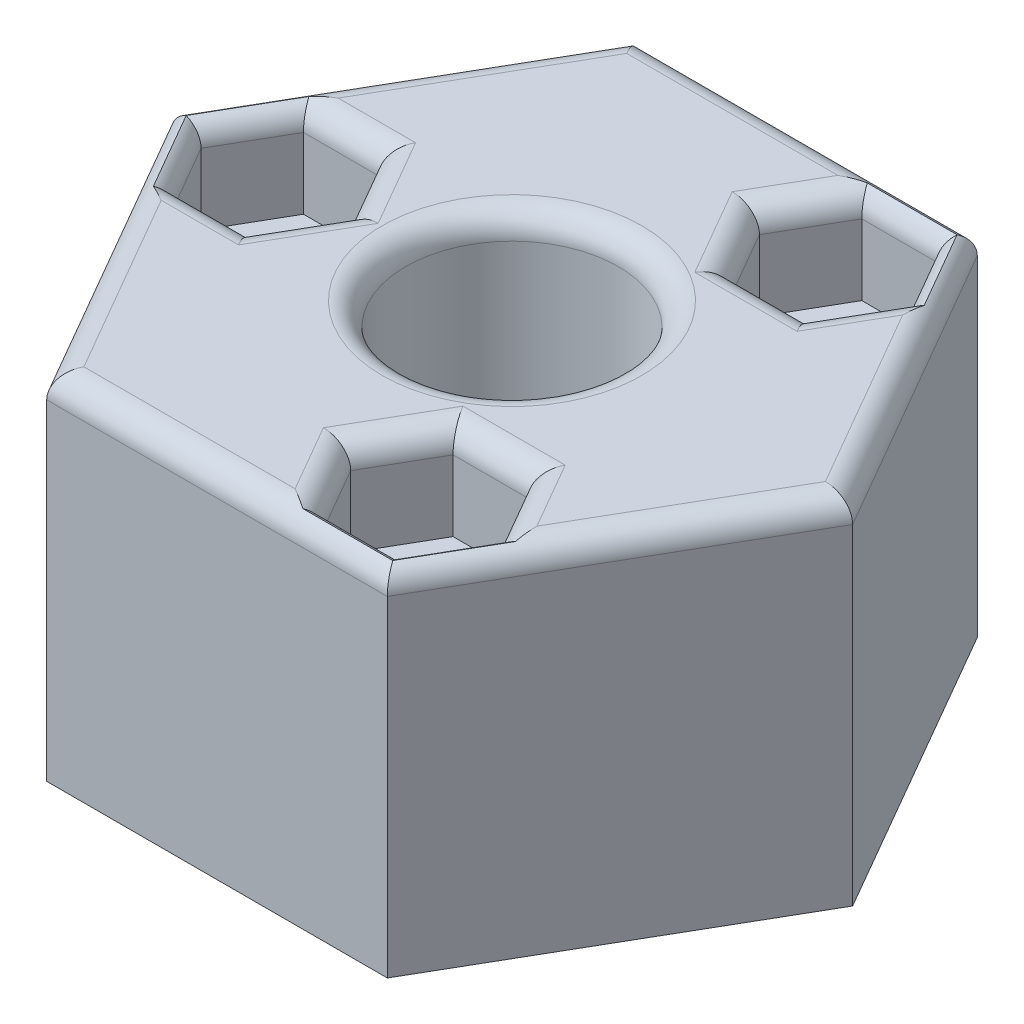
from build123d import *

# Parameters (mm, degrees)
ESQUISSE1_R             = 1.2
BOSS_EXTRU_1_DEPTH      = 15
ESQUISSE2_R             = 7.621023553
ESQUISSE2_R_2           = 4.5
BOSS_EXTRU_2_DEPTH      = 8.2
ENL_V_MAT_EXTRU_1_DEPTH = 4
CONG_1_R                = 1


with BuildPart() as part:
    # Esquisse1 → Boss.-Extru.1 (new body)
    with BuildSketch(Plane(origin=(0, 0, 0), x_dir=(1, 0, 0), z_dir=(0, 1, 0))):
        Polygon((7.216878365, 12.5), (-7.216878365, 12.5), (-14.43375673, 0), (-7.216878365, -12.5), (7.216878365, -12.5), (14.43375673, 0), align=None)
        with Locations(Location((-10, 0, 0), (0, 0, 270))):
            Circle(ESQUISSE1_R, mode=Mode.SUBTRACT)
        with Locations(Location((5, 8.660254038, 0), (0, 0, 270))):
            Circle(ESQUISSE1_R, mode=Mode.SUBTRACT)
        with Locations(Location((5, -8.660254038, 0), (0, 0, 270))):
            Circle(ESQUISSE1_R, mode=Mode.SUBTRACT)
        Polygon((6.6, 3.810511777), (0, 7.621023553), (-6.6, 3.810511777), (-6.6, -3.810511777), (0, -7.621023553), (6.6, -3.810511777), align=None, mode=Mode.SUBTRACT)
    extrude(amount=BOSS_EXTRU_1_DEPTH)

    # Esquisse2 → Boss.-Extru.2 (add)
    with BuildSketch(Plane(origin=(0, 15, 0), x_dir=(1, 0, 0), z_dir=(0, 1, 0))):
        Circle(ESQUISSE2_R)
        with Locations(Location((0, 0, 0), (0, 0, 270))):
            Circle(ESQUISSE2_R_2, mode=Mode.SUBTRACT)
    extrude(amount=-BOSS_EXTRU_2_DEPTH)

    # Esquisse3 → Enlèv. mat.-Extru.1 (cut)
    with BuildSketch(Plane(origin=(0, 15, 0), x_dir=(1, 0, 0), z_dir=(0, 1, 0))):
        Polygon((-8.41228676, 2.75), (-11.58771324, 2.75), (-13.175426481, 0), (-11.58771324, -2.75), (-8.41228676, -2.75), (-6.824573519, 0), align=None)
        Polygon((6.58771324, 5.910254038), (8.175426481, 8.660254038), (6.58771324, 11.410254038), (3.41228676, 11.410254038), (1.824573519, 8.660254038), (3.41228676, 5.910254038), align=None)
        Polygon((6.58771324, -5.910254038), (3.41228676, -5.910254038), (1.824573519, -8.660254038), (3.41228676, -11.410254038), (6.58771324, -11.410254038), (8.175426481, -8.660254038), align=None)
    extrude(amount=-ENL_V_MAT_EXTRU_1_DEPTH, mode=Mode.SUBTRACT)

    # Congé1
    # the kernel refuses this fillet: 1 mm, written as the material it takes off along each edge
    with BuildSketch(Plane(origin=(-5.966878365, 15, -14.665063509), x_dir=(0, -1, 0), z_dir=(-0.5000000000000001, 0, 0.8660254037844387)), Plane(origin=(15.68375673, 15, 2.165063509), x_dir=(0, -1, 0), z_dir=(-0.5000000000000003, 0, -0.8660254037844386)), Plane(origin=(9.716878365, 15, -12.5), x_dir=(0, -1, 0), z_dir=(-1, 0, 0))) as cong_1_piece_1:
        with BuildLine():
            CenterArc((CONG_1_R, CONG_1_R), CONG_1_R, 180, 90)
            Line((0, CONG_1_R), (0, 0))
            Line((0, 0), (CONG_1_R, 0))
        make_face()
    extrude(amount=19.43375673, mode=Mode.SUBTRACT)
    with BuildSketch(Plane(origin=(0.91228676, 15, -5.910254038), x_dir=(0, 0, 1), z_dir=(1, 0, 0))) as cong_1_piece_2_section:
        with BuildLine():
            CenterArc((CONG_1_R, CONG_1_R), CONG_1_R, 180, 90)
            Line((0, CONG_1_R), (0, 0))
            Line((0, 0), (CONG_1_R, 0))
        make_face()
    cong_1_piece_2 = extrude(amount=8.175426481, mode=Mode.PRIVATE)
    cong_1_piece_2 = split(cong_1_piece_2, bisect_by=Plane(origin=(6.100727663, 14.76272493, -5.066770275), z_dir=(-0.8660254037844387, 0, -0.5000000000000003)), keep=Keep.TOP, mode=Mode.PRIVATE)
    cong_1_piece_2 = split(cong_1_piece_2, bisect_by=Plane(origin=(3.899272337, 14.76272493, -5.066770275), z_dir=(0.8660254037844388, 0, -0.49999999999999967)), keep=Keep.TOP, mode=Mode.PRIVATE)
    add(cong_1_piece_2, mode=Mode.SUBTRACT)
    with BuildSketch(Plane(origin=(5.33771324, 15, -3.745190528), x_dir=(0.8660254037844386, 0, 0.5000000000000003), z_dir=(0.5000000000000003, 0, -0.8660254037844386))) as cong_1_piece_3_section:
        with BuildLine():
            CenterArc((CONG_1_R, CONG_1_R), CONG_1_R, 180, 90)
            Line((0, CONG_1_R), (0, 0))
            Line((0, 0), (CONG_1_R, 0))
        make_face()
    cong_1_piece_3 = extrude(amount=8.175426481, mode=Mode.PRIVATE)
    cong_1_piece_3 = split(cong_1_piece_3, bisect_by=Plane(origin=(7.561684395, 14.76272493, -5.910254038), z_dir=(0, 0, -1)), keep=Keep.TOP, mode=Mode.PRIVATE)
    cong_1_piece_3 = split(cong_1_piece_3, bisect_by=Plane(origin=(8.662412058, 14.76272493, -7.816770275), z_dir=(-0.8660254037844387, 0, 0.49999999999999983)), keep=Keep.TOP, mode=Mode.PRIVATE)
    add(cong_1_piece_3, mode=Mode.SUBTRACT)
    with BuildSketch(Plane(origin=(9.425426481, 15, -6.495190528), x_dir=(0.8660254037844387, 0, -0.4999999999999998), z_dir=(-0.4999999999999999, 0, -0.8660254037844388))) as cong_1_piece_4_section:
        with BuildLine():
            CenterArc((CONG_1_R, CONG_1_R), CONG_1_R, 180, 90)
            Line((0, CONG_1_R), (0, 0))
            Line((0, 0), (CONG_1_R, 0))
        make_face()
    cong_1_piece_4 = extrude(amount=8.175426481, mode=Mode.PRIVATE)
    cong_1_piece_4 = split(cong_1_piece_4, bisect_by=Plane(origin=(8.662412058, 14.76272493, -9.5037378), z_dir=(-0.8660254037844387, 0, -0.5000000000000003)), keep=Keep.TOP, mode=Mode.PRIVATE)
    cong_1_piece_4 = split(cong_1_piece_4, bisect_by=Plane(origin=(7.561684395, 14.76272493, -11.410254038), z_dir=(0, 0, 1)), keep=Keep.TOP, mode=Mode.PRIVATE)
    add(cong_1_piece_4, mode=Mode.SUBTRACT)
    with BuildSketch(Plane(origin=(9.08771324, 15, -11.410254038), x_dir=(0, 0, -1), z_dir=(-1, 0, 0))) as cong_1_piece_5_section:
        with BuildLine():
            CenterArc((CONG_1_R, CONG_1_R), CONG_1_R, 180, 90)
            Line((0, CONG_1_R), (0, 0))
            Line((0, 0), (CONG_1_R, 0))
        make_face()
    cong_1_piece_5 = extrude(amount=8.175426481, mode=Mode.PRIVATE)
    cong_1_piece_5 = split(cong_1_piece_5, bisect_by=Plane(origin=(6.100727663, 14.76272493, -12.2537378), z_dir=(-0.8660254037844387, 0, 0.49999999999999983)), keep=Keep.TOP, mode=Mode.PRIVATE)
    cong_1_piece_5 = split(cong_1_piece_5, bisect_by=Plane(origin=(3.899272337, 14.76272493, -12.2537378), z_dir=(0.8660254037844384, 0, 0.5000000000000004)), keep=Keep.TOP, mode=Mode.PRIVATE)
    add(cong_1_piece_5, mode=Mode.SUBTRACT)
    with BuildSketch(Plane(origin=(4.66228676, 15, -13.575317547), x_dir=(-0.8660254037844385, 0, -0.5000000000000006), z_dir=(-0.5000000000000004, 0, 0.8660254037844384))) as cong_1_piece_6_section:
        with BuildLine():
            CenterArc((CONG_1_R, CONG_1_R), CONG_1_R, 180, 90)
            Line((0, CONG_1_R), (0, 0))
            Line((0, 0), (CONG_1_R, 0))
        make_face()
    cong_1_piece_6 = extrude(amount=8.175426481, mode=Mode.PRIVATE)
    cong_1_piece_6 = split(cong_1_piece_6, bisect_by=Plane(origin=(2.438315605, 14.76272493, -11.410254038), z_dir=(0, 0, 1)), keep=Keep.TOP, mode=Mode.PRIVATE)
    cong_1_piece_6 = split(cong_1_piece_6, bisect_by=Plane(origin=(1.337587942, 14.76272493, -9.5037378), z_dir=(0.8660254037844388, 0, -0.49999999999999967)), keep=Keep.TOP, mode=Mode.PRIVATE)
    add(cong_1_piece_6, mode=Mode.SUBTRACT)
    with BuildSketch(Plane(origin=(0.574573519, 15, -10.825317547), x_dir=(-0.8660254037844388, 0, 0.4999999999999997), z_dir=(0.49999999999999967, 0, 0.8660254037844388))) as cong_1_piece_7_section:
        with BuildLine():
            CenterArc((CONG_1_R, CONG_1_R), CONG_1_R, 180, 90)
            Line((0, CONG_1_R), (0, 0))
            Line((0, 0), (CONG_1_R, 0))
        make_face()
    cong_1_piece_7 = extrude(amount=8.175426481, mode=Mode.PRIVATE)
    cong_1_piece_7 = split(cong_1_piece_7, bisect_by=Plane(origin=(1.337587942, 14.76272493, -7.816770275), z_dir=(0.8660254037844384, 0, 0.5000000000000004)), keep=Keep.TOP, mode=Mode.PRIVATE)
    cong_1_piece_7 = split(cong_1_piece_7, bisect_by=Plane(origin=(2.438315605, 14.76272493, -5.910254038), z_dir=(0, 0, -1)), keep=Keep.TOP, mode=Mode.PRIVATE)
    add(cong_1_piece_7, mode=Mode.SUBTRACT)
    with BuildSketch(Plane(origin=(9.425426481, 15, 10.825317547), x_dir=(0.8660254037844384, 0, -0.5000000000000004), z_dir=(-0.5000000000000004, 0, -0.8660254037844384))) as cong_1_piece_8_section:
        with BuildLine():
            CenterArc((CONG_1_R, CONG_1_R), CONG_1_R, 180, 90)
            Line((0, CONG_1_R), (0, 0))
            Line((0, 0), (CONG_1_R, 0))
        make_face()
    cong_1_piece_8 = extrude(amount=8.175426481, mode=Mode.PRIVATE)
    cong_1_piece_8 = split(cong_1_piece_8, bisect_by=Plane(origin=(7.561684395, 14.76272493, 5.910254038), z_dir=(0, 0, 1)), keep=Keep.TOP, mode=Mode.PRIVATE)
    cong_1_piece_8 = split(cong_1_piece_8, bisect_by=Plane(origin=(8.662412058, 14.76272493, 7.816770275), z_dir=(-0.8660254037844388, 0, -0.4999999999999998)), keep=Keep.TOP, mode=Mode.PRIVATE)
    add(cong_1_piece_8, mode=Mode.SUBTRACT)
    with BuildSketch(Plane(origin=(9.08771324, 15, 5.910254038), x_dir=(0, 0, -1), z_dir=(-1, 0, 0))) as cong_1_piece_9_section:
        with BuildLine():
            CenterArc((CONG_1_R, CONG_1_R), CONG_1_R, 180, 90)
            Line((0, CONG_1_R), (0, 0))
            Line((0, 0), (CONG_1_R, 0))
        make_face()
    cong_1_piece_9 = extrude(amount=8.175426481, mode=Mode.PRIVATE)
    cong_1_piece_9 = split(cong_1_piece_9, bisect_by=Plane(origin=(6.100727663, 14.76272493, 5.066770275), z_dir=(-0.8660254037844384, 0, 0.5000000000000004)), keep=Keep.TOP, mode=Mode.PRIVATE)
    cong_1_piece_9 = split(cong_1_piece_9, bisect_by=Plane(origin=(3.899272337, 14.76272493, 5.066770275), z_dir=(0.8660254037844389, 0, 0.49999999999999956)), keep=Keep.TOP, mode=Mode.PRIVATE)
    add(cong_1_piece_9, mode=Mode.SUBTRACT)
    with BuildSketch(Plane(origin=(4.66228676, 15, 3.745190528), x_dir=(-0.8660254037844389, 0, -0.49999999999999956), z_dir=(-0.49999999999999956, 0, 0.8660254037844389))) as cong_1_piece_10_section:
        with BuildLine():
            CenterArc((CONG_1_R, CONG_1_R), CONG_1_R, 180, 90)
            Line((0, CONG_1_R), (0, 0))
            Line((0, 0), (CONG_1_R, 0))
        make_face()
    cong_1_piece_10 = extrude(amount=8.175426481, mode=Mode.PRIVATE)
    cong_1_piece_10 = split(cong_1_piece_10, bisect_by=Plane(origin=(2.438315605, 14.76272493, 5.910254038), z_dir=(0, 0, 1)), keep=Keep.TOP, mode=Mode.PRIVATE)
    cong_1_piece_10 = split(cong_1_piece_10, bisect_by=Plane(origin=(1.337587942, 14.76272493, 7.816770275), z_dir=(0.8660254037844384, 0, -0.5000000000000007)), keep=Keep.TOP, mode=Mode.PRIVATE)
    add(cong_1_piece_10, mode=Mode.SUBTRACT)
    with BuildSketch(Plane(origin=(0.574573519, 15, 6.495190528), x_dir=(-0.8660254037844384, 0, 0.5000000000000007), z_dir=(0.5000000000000007, 0, 0.8660254037844384))) as cong_1_piece_11_section:
        with BuildLine():
            CenterArc((CONG_1_R, CONG_1_R), CONG_1_R, 180, 90)
            Line((0, CONG_1_R), (0, 0))
            Line((0, 0), (CONG_1_R, 0))
        make_face()
    cong_1_piece_11 = extrude(amount=8.175426481, mode=Mode.PRIVATE)
    cong_1_piece_11 = split(cong_1_piece_11, bisect_by=Plane(origin=(1.337587942, 14.76272493, 9.5037378), z_dir=(0.8660254037844389, 0, 0.49999999999999956)), keep=Keep.TOP, mode=Mode.PRIVATE)
    cong_1_piece_11 = split(cong_1_piece_11, bisect_by=Plane(origin=(2.438315605, 14.76272493, 11.410254038), z_dir=(0, 0, -1)), keep=Keep.TOP, mode=Mode.PRIVATE)
    add(cong_1_piece_11, mode=Mode.SUBTRACT)
    with BuildSketch(Plane(origin=(0.91228676, 15, 11.410254038), x_dir=(0, 0, 1), z_dir=(1, 0, 0))) as cong_1_piece_12_section:
        with BuildLine():
            CenterArc((CONG_1_R, CONG_1_R), CONG_1_R, 180, 90)
            Line((0, CONG_1_R), (0, 0))
            Line((0, 0), (CONG_1_R, 0))
        make_face()
    cong_1_piece_12 = extrude(amount=8.175426481, mode=Mode.PRIVATE)
    cong_1_piece_12 = split(cong_1_piece_12, bisect_by=Plane(origin=(3.899272337, 14.76272493, 12.2537378), z_dir=(0.8660254037844384, 0, -0.5000000000000007)), keep=Keep.TOP, mode=Mode.PRIVATE)
    cong_1_piece_12 = split(cong_1_piece_12, bisect_by=Plane(origin=(6.100727663, 14.76272493, 12.2537378), z_dir=(-0.8660254037844388, 0, -0.4999999999999998)), keep=Keep.TOP, mode=Mode.PRIVATE)
    add(cong_1_piece_12, mode=Mode.SUBTRACT)
    with BuildSketch(Plane(origin=(5.33771324, 15, 13.575317547), x_dir=(0.8660254037844388, 0, 0.4999999999999998), z_dir=(0.4999999999999998, 0, -0.8660254037844388))) as cong_1_piece_13_section:
        with BuildLine():
            CenterArc((CONG_1_R, CONG_1_R), CONG_1_R, 180, 90)
            Line((0, CONG_1_R), (0, 0))
            Line((0, 0), (CONG_1_R, 0))
        make_face()
    cong_1_piece_13 = extrude(amount=8.175426481, mode=Mode.PRIVATE)
    cong_1_piece_13 = split(cong_1_piece_13, bisect_by=Plane(origin=(7.561684395, 14.76272493, 11.410254038), z_dir=(0, 0, -1)), keep=Keep.TOP, mode=Mode.PRIVATE)
    cong_1_piece_13 = split(cong_1_piece_13, bisect_by=Plane(origin=(8.662412058, 14.76272493, 9.5037378), z_dir=(-0.8660254037844384, 0, 0.5000000000000004)), keep=Keep.TOP, mode=Mode.PRIVATE)
    add(cong_1_piece_13, mode=Mode.SUBTRACT)
    with BuildSketch(Plane(origin=(-15.68375673, 15, -2.165063509), x_dir=(0.8660254037844387, 0, -0.5000000000000002), z_dir=(0.5000000000000002, 0, 0.8660254037844386)), Plane(origin=(-9.716878365, 15, 12.5), x_dir=(0, 0, -1), z_dir=(1, 0, 0)), Plane(origin=(5.966878365, 15, 14.665063509), x_dir=(-0.8660254037844386, 0, -0.5000000000000001), z_dir=(0.5000000000000001, 0, -0.8660254037844386))) as cong_1_piece_14:
        with BuildLine():
            CenterArc((CONG_1_R, -CONG_1_R), CONG_1_R, 90, 90)
            Line((0, -CONG_1_R), (0, 0))
            Line((0, 0), (CONG_1_R, 0))
        make_face()
    extrude(amount=19.43375673, mode=Mode.SUBTRACT)
    with BuildSketch(Plane(origin=(0, 15, 0), x_dir=(0, 0, 1), z_dir=(-1, 0, 0))) as cong_1_piece_15:
        with BuildLine():
            CenterArc((4.5 + CONG_1_R, -CONG_1_R), CONG_1_R, 90, 90)
            Line((4.5, -CONG_1_R), (4.5, 0))
            Line((4.5, 0), (4.5 + CONG_1_R, 0))
        make_face()
    revolve(axis=Axis((0, 15, 0), (0, 1, 0)), mode=Mode.SUBTRACT)
    with BuildSketch(Plane(origin=(-5.574573519, 15, 2.165063509), x_dir=(0.8660254037844385, 0, -0.5000000000000003), z_dir=(-0.5000000000000003, 0, -0.8660254037844385))) as cong_1_piece_16_section:
        with BuildLine():
            CenterArc((CONG_1_R, CONG_1_R), CONG_1_R, 180, 90)
            Line((0, CONG_1_R), (0, 0))
            Line((0, 0), (CONG_1_R, 0))
        make_face()
    cong_1_piece_16 = extrude(amount=8.175426481, mode=Mode.PRIVATE)
    cong_1_piece_16 = split(cong_1_piece_16, bisect_by=Plane(origin=(-7.438315605, 14.76272493, -2.75), z_dir=(0, 0, 1)), keep=Keep.TOP, mode=Mode.PRIVATE)
    cong_1_piece_16 = split(cong_1_piece_16, bisect_by=Plane(origin=(-6.337587942, 14.76272493, -0.843483763), z_dir=(-0.8660254037844388, 0, -0.4999999999999999)), keep=Keep.TOP, mode=Mode.PRIVATE)
    add(cong_1_piece_16, mode=Mode.SUBTRACT)
    with BuildSketch(Plane(origin=(-5.91228676, 15, -2.75), x_dir=(0, 0, -1), z_dir=(-1, 0, 0))) as cong_1_piece_17_section:
        with BuildLine():
            CenterArc((CONG_1_R, CONG_1_R), CONG_1_R, 180, 90)
            Line((0, CONG_1_R), (0, 0))
            Line((0, 0), (CONG_1_R, 0))
        make_face()
    cong_1_piece_17 = extrude(amount=8.175426481, mode=Mode.PRIVATE)
    cong_1_piece_17 = split(cong_1_piece_17, bisect_by=Plane(origin=(-8.899272337, 14.76272493, -3.593483763), z_dir=(-0.8660254037844385, 0, 0.5000000000000003)), keep=Keep.TOP, mode=Mode.PRIVATE)
    cong_1_piece_17 = split(cong_1_piece_17, bisect_by=Plane(origin=(-11.100727663, 14.76272493, -3.593483763), z_dir=(0.8660254037844392, 0, 0.49999999999999917)), keep=Keep.TOP, mode=Mode.PRIVATE)
    add(cong_1_piece_17, mode=Mode.SUBTRACT)
    with BuildSketch(Plane(origin=(-10.33771324, 15, -4.915063509), x_dir=(-0.866025403784439, 0, -0.4999999999999991), z_dir=(-0.49999999999999917, 0, 0.8660254037844392))) as cong_1_piece_18_section:
        with BuildLine():
            CenterArc((CONG_1_R, CONG_1_R), CONG_1_R, 180, 90)
            Line((0, CONG_1_R), (0, 0))
            Line((0, 0), (CONG_1_R, 0))
        make_face()
    cong_1_piece_18 = extrude(amount=8.175426481, mode=Mode.PRIVATE)
    cong_1_piece_18 = split(cong_1_piece_18, bisect_by=Plane(origin=(-12.561684395, 14.76272493, -2.75), z_dir=(0, 0, 1)), keep=Keep.TOP, mode=Mode.PRIVATE)
    cong_1_piece_18 = split(cong_1_piece_18, bisect_by=Plane(origin=(-13.662412058, 14.76272493, -0.843483763), z_dir=(0.8660254037844386, 0, -0.5000000000000001)), keep=Keep.TOP, mode=Mode.PRIVATE)
    add(cong_1_piece_18, mode=Mode.SUBTRACT)
    with BuildSketch(Plane(origin=(-14.425426481, 15, -2.165063509), x_dir=(-0.8660254037844387, 0, 0.5000000000000001), z_dir=(0.5000000000000001, 0, 0.8660254037844386))) as cong_1_piece_19_section:
        with BuildLine():
            CenterArc((CONG_1_R, CONG_1_R), CONG_1_R, 180, 90)
            Line((0, CONG_1_R), (0, 0))
            Line((0, 0), (CONG_1_R, 0))
        make_face()
    cong_1_piece_19 = extrude(amount=8.175426481, mode=Mode.PRIVATE)
    cong_1_piece_19 = split(cong_1_piece_19, bisect_by=Plane(origin=(-13.662412058, 14.76272493, 0.843483763), z_dir=(0.8660254037844392, 0, 0.49999999999999917)), keep=Keep.TOP, mode=Mode.PRIVATE)
    cong_1_piece_19 = split(cong_1_piece_19, bisect_by=Plane(origin=(-12.561684395, 14.76272493, 2.75), z_dir=(0, 0, -1)), keep=Keep.TOP, mode=Mode.PRIVATE)
    add(cong_1_piece_19, mode=Mode.SUBTRACT)
    with BuildSketch(Plane(origin=(-14.08771324, 15, 2.75), x_dir=(0, 0, 1), z_dir=(1, 0, 0))) as cong_1_piece_20_section:
        with BuildLine():
            CenterArc((CONG_1_R, CONG_1_R), CONG_1_R, 180, 90)
            Line((0, CONG_1_R), (0, 0))
            Line((0, 0), (CONG_1_R, 0))
        make_face()
    cong_1_piece_20 = extrude(amount=8.175426481, mode=Mode.PRIVATE)
    cong_1_piece_20 = split(cong_1_piece_20, bisect_by=Plane(origin=(-11.100727663, 14.76272493, 3.593483763), z_dir=(0.8660254037844386, 0, -0.5000000000000001)), keep=Keep.TOP, mode=Mode.PRIVATE)
    cong_1_piece_20 = split(cong_1_piece_20, bisect_by=Plane(origin=(-8.899272337, 14.76272493, 3.593483763), z_dir=(-0.8660254037844388, 0, -0.4999999999999999)), keep=Keep.TOP, mode=Mode.PRIVATE)
    add(cong_1_piece_20, mode=Mode.SUBTRACT)
    with BuildSketch(Plane(origin=(-9.66228676, 15, 4.915063509), x_dir=(0.8660254037844388, 0, 0.4999999999999999), z_dir=(0.49999999999999994, 0, -0.8660254037844388))) as cong_1_piece_21_section:
        with BuildLine():
            CenterArc((CONG_1_R, CONG_1_R), CONG_1_R, 180, 90)
            Line((0, CONG_1_R), (0, 0))
            Line((0, 0), (CONG_1_R, 0))
        make_face()
    cong_1_piece_21 = extrude(amount=8.175426481, mode=Mode.PRIVATE)
    cong_1_piece_21 = split(cong_1_piece_21, bisect_by=Plane(origin=(-7.438315605, 14.76272493, 2.75), z_dir=(0, 0, -1)), keep=Keep.TOP, mode=Mode.PRIVATE)
    cong_1_piece_21 = split(cong_1_piece_21, bisect_by=Plane(origin=(-6.337587942, 14.76272493, 0.843483763), z_dir=(-0.8660254037844385, 0, 0.5000000000000003)), keep=Keep.TOP, mode=Mode.PRIVATE)
    add(cong_1_piece_21, mode=Mode.SUBTRACT)
    with BuildSketch(Plane(origin=(0.574573519, 15, -10.825317547), x_dir=(-0.8660254037844388, 0, 0.4999999999999997), z_dir=(0.49999999999999967, 0, 0.8660254037844388))) as cong_1_piece_22a_section:
        with BuildLine():
            CenterArc((CONG_1_R, CONG_1_R), CONG_1_R, 180, 90)
            Line((0, CONG_1_R), (0, 0))
            Line((0, 0), (CONG_1_R, 0))
        make_face()
    cong_1_piece_22a = extrude(amount=8.175426481, mode=Mode.PRIVATE)
    cong_1_piece_22a = split(cong_1_piece_22a, bisect_by=Plane(origin=(3.798239793, 14.77963069, -5.910254038), z_dir=(0, 0, 1)), keep=Keep.TOP, mode=Mode.PRIVATE)
    with BuildSketch(Plane(origin=(0.91228676, 15, -5.910254038), x_dir=(0, 0, 1), z_dir=(1, 0, 0))) as cong_1_piece_22b_section:
        with BuildLine():
            CenterArc((CONG_1_R, CONG_1_R), CONG_1_R, 180, 90)
            Line((0, CONG_1_R), (0, 0))
            Line((0, 0), (CONG_1_R, 0))
        make_face()
    cong_1_piece_22b = extrude(amount=8.175426481, mode=Mode.PRIVATE)
    cong_1_piece_22b = split(cong_1_piece_22b, bisect_by=Plane(origin=(3.219310243, 14.77963069, -6.244499169), z_dir=(-0.8660254037844388, 0, 0.49999999999999967)), keep=Keep.TOP, mode=Mode.PRIVATE)
    cong_1_piece_22 = cong_1_piece_22a & cong_1_piece_22b
    add(cong_1_piece_22, mode=Mode.SUBTRACT)
    with BuildSketch(Plane(origin=(5.33771324, 15, -3.745190528), x_dir=(0.8660254037844386, 0, 0.5000000000000003), z_dir=(0.5000000000000003, 0, -0.8660254037844386))) as cong_1_piece_23a_section:
        with BuildLine():
            CenterArc((CONG_1_R, CONG_1_R), CONG_1_R, 180, 90)
            Line((0, CONG_1_R), (0, 0))
            Line((0, 0), (CONG_1_R, 0))
        make_face()
    cong_1_piece_23a = extrude(amount=8.175426481, mode=Mode.PRIVATE)
    cong_1_piece_23a = split(cong_1_piece_23a, bisect_by=Plane(origin=(6.201760207, 14.77963069, -5.910254038), z_dir=(0, 0, 1)), keep=Keep.TOP, mode=Mode.PRIVATE)
    with BuildSketch(Plane(origin=(0.91228676, 15, -5.910254038), x_dir=(0, 0, 1), z_dir=(1, 0, 0))) as cong_1_piece_23b_section:
        with BuildLine():
            CenterArc((CONG_1_R, CONG_1_R), CONG_1_R, 180, 90)
            Line((0, CONG_1_R), (0, 0))
            Line((0, 0), (CONG_1_R, 0))
        make_face()
    cong_1_piece_23b = extrude(amount=8.175426481, mode=Mode.PRIVATE)
    cong_1_piece_23b = split(cong_1_piece_23b, bisect_by=Plane(origin=(6.780689757, 14.77963069, -6.244499169), z_dir=(0.8660254037844387, 0, 0.5000000000000003)), keep=Keep.TOP, mode=Mode.PRIVATE)
    cong_1_piece_23 = cong_1_piece_23a & cong_1_piece_23b
    add(cong_1_piece_23, mode=Mode.SUBTRACT)
    with BuildSketch(Plane(origin=(5.33771324, 15, -3.745190528), x_dir=(0.8660254037844386, 0, 0.5000000000000003), z_dir=(0.5000000000000003, 0, -0.8660254037844386))) as cong_1_piece_24a_section:
        with BuildLine():
            CenterArc((CONG_1_R, CONG_1_R), CONG_1_R, 180, 90)
            Line((0, CONG_1_R), (0, 0))
            Line((0, 0), (CONG_1_R, 0))
        make_face()
    cong_1_piece_24a = extrude(amount=8.175426481, mode=Mode.PRIVATE)
    cong_1_piece_24a = split(cong_1_piece_24a, bisect_by=Plane(origin=(7.982449964, 14.77963069, -8.994499169), z_dir=(0.8660254037844387, 0, -0.49999999999999983)), keep=Keep.TOP, mode=Mode.PRIVATE)
    with BuildSketch(Plane(origin=(9.425426481, 15, -6.495190528), x_dir=(0.8660254037844387, 0, -0.4999999999999998), z_dir=(-0.4999999999999999, 0, -0.8660254037844388))) as cong_1_piece_24b_section:
        with BuildLine():
            CenterArc((CONG_1_R, CONG_1_R), CONG_1_R, 180, 90)
            Line((0, CONG_1_R), (0, 0))
            Line((0, 0), (CONG_1_R, 0))
        make_face()
    cong_1_piece_24b = extrude(amount=8.175426481, mode=Mode.PRIVATE)
    cong_1_piece_24b = split(cong_1_piece_24b, bisect_by=Plane(origin=(7.982449964, 14.77963069, -8.326008907), z_dir=(0.8660254037844387, 0, 0.5000000000000003)), keep=Keep.TOP, mode=Mode.PRIVATE)
    cong_1_piece_24 = cong_1_piece_24a & cong_1_piece_24b
    add(cong_1_piece_24, mode=Mode.SUBTRACT)
    with BuildSketch(Plane(origin=(9.425426481, 15, -6.495190528), x_dir=(0.8660254037844387, 0, -0.4999999999999998), z_dir=(-0.4999999999999999, 0, -0.8660254037844388))) as cong_1_piece_25a_section:
        with BuildLine():
            CenterArc((CONG_1_R, CONG_1_R), CONG_1_R, 180, 90)
            Line((0, CONG_1_R), (0, 0))
            Line((0, 0), (CONG_1_R, 0))
        make_face()
    cong_1_piece_25a = extrude(amount=8.175426481, mode=Mode.PRIVATE)
    cong_1_piece_25a = split(cong_1_piece_25a, bisect_by=Plane(origin=(6.201760207, 14.77963069, -11.410254038), z_dir=(0, 0, -1)), keep=Keep.TOP, mode=Mode.PRIVATE)
    with BuildSketch(Plane(origin=(9.08771324, 15, -11.410254038), x_dir=(0, 0, -1), z_dir=(-1, 0, 0))) as cong_1_piece_25b_section:
        with BuildLine():
            CenterArc((CONG_1_R, CONG_1_R), CONG_1_R, 180, 90)
            Line((0, CONG_1_R), (0, 0))
            Line((0, 0), (CONG_1_R, 0))
        make_face()
    cong_1_piece_25b = extrude(amount=8.175426481, mode=Mode.PRIVATE)
    cong_1_piece_25b = split(cong_1_piece_25b, bisect_by=Plane(origin=(6.780689757, 14.77963069, -11.076008907), z_dir=(0.8660254037844387, 0, -0.49999999999999983)), keep=Keep.TOP, mode=Mode.PRIVATE)
    cong_1_piece_25 = cong_1_piece_25a & cong_1_piece_25b
    add(cong_1_piece_25, mode=Mode.SUBTRACT)
    with BuildSketch(Plane(origin=(9.08771324, 15, -11.410254038), x_dir=(0, 0, -1), z_dir=(-1, 0, 0))) as cong_1_piece_26a_section:
        with BuildLine():
            CenterArc((CONG_1_R, CONG_1_R), CONG_1_R, 180, 90)
            Line((0, CONG_1_R), (0, 0))
            Line((0, 0), (CONG_1_R, 0))
        make_face()
    cong_1_piece_26a = extrude(amount=8.175426481, mode=Mode.PRIVATE)
    cong_1_piece_26a = split(cong_1_piece_26a, bisect_by=Plane(origin=(3.219310243, 14.77963069, -11.076008907), z_dir=(-0.8660254037844384, 0, -0.5000000000000004)), keep=Keep.TOP, mode=Mode.PRIVATE)
    with BuildSketch(Plane(origin=(4.66228676, 15, -13.575317547), x_dir=(-0.8660254037844385, 0, -0.5000000000000006), z_dir=(-0.5000000000000004, 0, 0.8660254037844384))) as cong_1_piece_26b_section:
        with BuildLine():
            CenterArc((CONG_1_R, CONG_1_R), CONG_1_R, 180, 90)
            Line((0, CONG_1_R), (0, 0))
            Line((0, 0), (CONG_1_R, 0))
        make_face()
    cong_1_piece_26b = extrude(amount=8.175426481, mode=Mode.PRIVATE)
    cong_1_piece_26b = split(cong_1_piece_26b, bisect_by=Plane(origin=(3.798239793, 14.77963069, -11.410254038), z_dir=(0, 0, -1)), keep=Keep.TOP, mode=Mode.PRIVATE)
    cong_1_piece_26 = cong_1_piece_26a & cong_1_piece_26b
    add(cong_1_piece_26, mode=Mode.SUBTRACT)
    with BuildSketch(Plane(origin=(4.66228676, 15, -13.575317547), x_dir=(-0.8660254037844385, 0, -0.5000000000000006), z_dir=(-0.5000000000000004, 0, 0.8660254037844384))) as cong_1_piece_27a_section:
        with BuildLine():
            CenterArc((CONG_1_R, CONG_1_R), CONG_1_R, 180, 90)
            Line((0, CONG_1_R), (0, 0))
            Line((0, 0), (CONG_1_R, 0))
        make_face()
    cong_1_piece_27a = extrude(amount=8.175426481, mode=Mode.PRIVATE)
    cong_1_piece_27a = split(cong_1_piece_27a, bisect_by=Plane(origin=(2.017550036, 14.77963069, -8.326008907), z_dir=(-0.8660254037844388, 0, 0.49999999999999967)), keep=Keep.TOP, mode=Mode.PRIVATE)
    with BuildSketch(Plane(origin=(0.574573519, 15, -10.825317547), x_dir=(-0.8660254037844388, 0, 0.4999999999999997), z_dir=(0.49999999999999967, 0, 0.8660254037844388))) as cong_1_piece_27b_section:
        with BuildLine():
            CenterArc((CONG_1_R, CONG_1_R), CONG_1_R, 180, 90)
            Line((0, CONG_1_R), (0, 0))
            Line((0, 0), (CONG_1_R, 0))
        make_face()
    cong_1_piece_27b = extrude(amount=8.175426481, mode=Mode.PRIVATE)
    cong_1_piece_27b = split(cong_1_piece_27b, bisect_by=Plane(origin=(2.017550036, 14.77963069, -8.994499169), z_dir=(-0.8660254037844384, 0, -0.5000000000000004)), keep=Keep.TOP, mode=Mode.PRIVATE)
    cong_1_piece_27 = cong_1_piece_27a & cong_1_piece_27b
    add(cong_1_piece_27, mode=Mode.SUBTRACT)
    with BuildSketch(Plane(origin=(5.33771324, 15, 13.575317547), x_dir=(0.8660254037844388, 0, 0.4999999999999998), z_dir=(0.4999999999999998, 0, -0.8660254037844388))) as cong_1_piece_28a_section:
        with BuildLine():
            CenterArc((CONG_1_R, CONG_1_R), CONG_1_R, 180, 90)
            Line((0, CONG_1_R), (0, 0))
            Line((0, 0), (CONG_1_R, 0))
        make_face()
    cong_1_piece_28a = extrude(amount=8.175426481, mode=Mode.PRIVATE)
    cong_1_piece_28a = split(cong_1_piece_28a, bisect_by=Plane(origin=(7.982449964, 14.77963069, 8.326008907), z_dir=(0.8660254037844384, 0, -0.5000000000000004)), keep=Keep.TOP, mode=Mode.PRIVATE)
    with BuildSketch(Plane(origin=(9.425426481, 15, 10.825317547), x_dir=(0.8660254037844384, 0, -0.5000000000000004), z_dir=(-0.5000000000000004, 0, -0.8660254037844384))) as cong_1_piece_28b_section:
        with BuildLine():
            CenterArc((CONG_1_R, CONG_1_R), CONG_1_R, 180, 90)
            Line((0, CONG_1_R), (0, 0))
            Line((0, 0), (CONG_1_R, 0))
        make_face()
    cong_1_piece_28b = extrude(amount=8.175426481, mode=Mode.PRIVATE)
    cong_1_piece_28b = split(cong_1_piece_28b, bisect_by=Plane(origin=(7.982449964, 14.77963069, 8.994499169), z_dir=(0.8660254037844388, 0, 0.4999999999999998)), keep=Keep.TOP, mode=Mode.PRIVATE)
    cong_1_piece_28 = cong_1_piece_28a & cong_1_piece_28b
    add(cong_1_piece_28, mode=Mode.SUBTRACT)
    with BuildSketch(Plane(origin=(9.08771324, 15, 5.910254038), x_dir=(0, 0, -1), z_dir=(-1, 0, 0))) as cong_1_piece_29a_section:
        with BuildLine():
            CenterArc((CONG_1_R, CONG_1_R), CONG_1_R, 180, 90)
            Line((0, CONG_1_R), (0, 0))
            Line((0, 0), (CONG_1_R, 0))
        make_face()
    cong_1_piece_29a = extrude(amount=8.175426481, mode=Mode.PRIVATE)
    cong_1_piece_29a = split(cong_1_piece_29a, bisect_by=Plane(origin=(6.780689757, 14.77963069, 6.244499169), z_dir=(0.8660254037844384, 0, -0.5000000000000004)), keep=Keep.TOP, mode=Mode.PRIVATE)
    with BuildSketch(Plane(origin=(9.425426481, 15, 10.825317547), x_dir=(0.8660254037844384, 0, -0.5000000000000004), z_dir=(-0.5000000000000004, 0, -0.8660254037844384))) as cong_1_piece_29b_section:
        with BuildLine():
            CenterArc((CONG_1_R, CONG_1_R), CONG_1_R, 180, 90)
            Line((0, CONG_1_R), (0, 0))
            Line((0, 0), (CONG_1_R, 0))
        make_face()
    cong_1_piece_29b = extrude(amount=8.175426481, mode=Mode.PRIVATE)
    cong_1_piece_29b = split(cong_1_piece_29b, bisect_by=Plane(origin=(6.201760207, 14.77963069, 5.910254038), z_dir=(0, 0, -1)), keep=Keep.TOP, mode=Mode.PRIVATE)
    cong_1_piece_29 = cong_1_piece_29a & cong_1_piece_29b
    add(cong_1_piece_29, mode=Mode.SUBTRACT)
    with BuildSketch(Plane(origin=(9.08771324, 15, 5.910254038), x_dir=(0, 0, -1), z_dir=(-1, 0, 0))) as cong_1_piece_30a_section:
        with BuildLine():
            CenterArc((CONG_1_R, CONG_1_R), CONG_1_R, 180, 90)
            Line((0, CONG_1_R), (0, 0))
            Line((0, 0), (CONG_1_R, 0))
        make_face()
    cong_1_piece_30a = extrude(amount=8.175426481, mode=Mode.PRIVATE)
    cong_1_piece_30a = split(cong_1_piece_30a, bisect_by=Plane(origin=(3.219310243, 14.77963069, 6.244499169), z_dir=(-0.8660254037844389, 0, -0.49999999999999956)), keep=Keep.TOP, mode=Mode.PRIVATE)
    with BuildSketch(Plane(origin=(4.66228676, 15, 3.745190528), x_dir=(-0.8660254037844389, 0, -0.49999999999999956), z_dir=(-0.49999999999999956, 0, 0.8660254037844389))) as cong_1_piece_30b_section:
        with BuildLine():
            CenterArc((CONG_1_R, CONG_1_R), CONG_1_R, 180, 90)
            Line((0, CONG_1_R), (0, 0))
            Line((0, 0), (CONG_1_R, 0))
        make_face()
    cong_1_piece_30b = extrude(amount=8.175426481, mode=Mode.PRIVATE)
    cong_1_piece_30b = split(cong_1_piece_30b, bisect_by=Plane(origin=(3.798239793, 14.77963069, 5.910254038), z_dir=(0, 0, -1)), keep=Keep.TOP, mode=Mode.PRIVATE)
    cong_1_piece_30 = cong_1_piece_30a & cong_1_piece_30b
    add(cong_1_piece_30, mode=Mode.SUBTRACT)
    with BuildSketch(Plane(origin=(4.66228676, 15, 3.745190528), x_dir=(-0.8660254037844389, 0, -0.49999999999999956), z_dir=(-0.49999999999999956, 0, 0.8660254037844389))) as cong_1_piece_31a_section:
        with BuildLine():
            CenterArc((CONG_1_R, CONG_1_R), CONG_1_R, 180, 90)
            Line((0, CONG_1_R), (0, 0))
            Line((0, 0), (CONG_1_R, 0))
        make_face()
    cong_1_piece_31a = extrude(amount=8.175426481, mode=Mode.PRIVATE)
    cong_1_piece_31a = split(cong_1_piece_31a, bisect_by=Plane(origin=(2.017550036, 14.77963069, 8.994499169), z_dir=(-0.8660254037844384, 0, 0.5000000000000007)), keep=Keep.TOP, mode=Mode.PRIVATE)
    with BuildSketch(Plane(origin=(0.574573519, 15, 6.495190528), x_dir=(-0.8660254037844384, 0, 0.5000000000000007), z_dir=(0.5000000000000007, 0, 0.8660254037844384))) as cong_1_piece_31b_section:
        with BuildLine():
            CenterArc((CONG_1_R, CONG_1_R), CONG_1_R, 180, 90)
            Line((0, CONG_1_R), (0, 0))
            Line((0, 0), (CONG_1_R, 0))
        make_face()
    cong_1_piece_31b = extrude(amount=8.175426481, mode=Mode.PRIVATE)
    cong_1_piece_31b = split(cong_1_piece_31b, bisect_by=Plane(origin=(2.017550036, 14.77963069, 8.326008907), z_dir=(-0.8660254037844389, 0, -0.49999999999999956)), keep=Keep.TOP, mode=Mode.PRIVATE)
    cong_1_piece_31 = cong_1_piece_31a & cong_1_piece_31b
    add(cong_1_piece_31, mode=Mode.SUBTRACT)
    with BuildSketch(Plane(origin=(0.574573519, 15, 6.495190528), x_dir=(-0.8660254037844384, 0, 0.5000000000000007), z_dir=(0.5000000000000007, 0, 0.8660254037844384))) as cong_1_piece_32a_section:
        with BuildLine():
            CenterArc((CONG_1_R, CONG_1_R), CONG_1_R, 180, 90)
            Line((0, CONG_1_R), (0, 0))
            Line((0, 0), (CONG_1_R, 0))
        make_face()
    cong_1_piece_32a = extrude(amount=8.175426481, mode=Mode.PRIVATE)
    cong_1_piece_32a = split(cong_1_piece_32a, bisect_by=Plane(origin=(3.798239793, 14.77963069, 11.410254038), z_dir=(0, 0, 1)), keep=Keep.TOP, mode=Mode.PRIVATE)
    with BuildSketch(Plane(origin=(0.91228676, 15, 11.410254038), x_dir=(0, 0, 1), z_dir=(1, 0, 0))) as cong_1_piece_32b_section:
        with BuildLine():
            CenterArc((CONG_1_R, CONG_1_R), CONG_1_R, 180, 90)
            Line((0, CONG_1_R), (0, 0))
            Line((0, 0), (CONG_1_R, 0))
        make_face()
    cong_1_piece_32b = extrude(amount=8.175426481, mode=Mode.PRIVATE)
    cong_1_piece_32b = split(cong_1_piece_32b, bisect_by=Plane(origin=(3.219310243, 14.77963069, 11.076008907), z_dir=(-0.8660254037844384, 0, 0.5000000000000007)), keep=Keep.TOP, mode=Mode.PRIVATE)
    cong_1_piece_32 = cong_1_piece_32a & cong_1_piece_32b
    add(cong_1_piece_32, mode=Mode.SUBTRACT)
    with BuildSketch(Plane(origin=(0.91228676, 15, 11.410254038), x_dir=(0, 0, 1), z_dir=(1, 0, 0))) as cong_1_piece_33a_section:
        with BuildLine():
            CenterArc((CONG_1_R, CONG_1_R), CONG_1_R, 180, 90)
            Line((0, CONG_1_R), (0, 0))
            Line((0, 0), (CONG_1_R, 0))
        make_face()
    cong_1_piece_33a = extrude(amount=8.175426481, mode=Mode.PRIVATE)
    cong_1_piece_33a = split(cong_1_piece_33a, bisect_by=Plane(origin=(6.780689757, 14.77963069, 11.076008907), z_dir=(0.8660254037844388, 0, 0.4999999999999998)), keep=Keep.TOP, mode=Mode.PRIVATE)
    with BuildSketch(Plane(origin=(5.33771324, 15, 13.575317547), x_dir=(0.8660254037844388, 0, 0.4999999999999998), z_dir=(0.4999999999999998, 0, -0.8660254037844388))) as cong_1_piece_33b_section:
        with BuildLine():
            CenterArc((CONG_1_R, CONG_1_R), CONG_1_R, 180, 90)
            Line((0, CONG_1_R), (0, 0))
            Line((0, 0), (CONG_1_R, 0))
        make_face()
    cong_1_piece_33b = extrude(amount=8.175426481, mode=Mode.PRIVATE)
    cong_1_piece_33b = split(cong_1_piece_33b, bisect_by=Plane(origin=(6.201760207, 14.77963069, 11.410254038), z_dir=(0, 0, 1)), keep=Keep.TOP, mode=Mode.PRIVATE)
    cong_1_piece_33 = cong_1_piece_33a & cong_1_piece_33b
    add(cong_1_piece_33, mode=Mode.SUBTRACT)
    with BuildSketch(Plane(origin=(-9.66228676, 15, 4.915063509), x_dir=(0.8660254037844388, 0, 0.4999999999999999), z_dir=(0.49999999999999994, 0, -0.8660254037844388))) as cong_1_piece_34a_section:
        with BuildLine():
            CenterArc((CONG_1_R, CONG_1_R), CONG_1_R, 180, 90)
            Line((0, CONG_1_R), (0, 0))
            Line((0, 0), (CONG_1_R, 0))
        make_face()
    cong_1_piece_34a = extrude(amount=8.175426481, mode=Mode.PRIVATE)
    cong_1_piece_34a = split(cong_1_piece_34a, bisect_by=Plane(origin=(-7.017550036, 14.77963069, -0.334245131), z_dir=(0.8660254037844385, 0, -0.5000000000000003)), keep=Keep.TOP, mode=Mode.PRIVATE)
    with BuildSketch(Plane(origin=(-5.574573519, 15, 2.165063509), x_dir=(0.8660254037844385, 0, -0.5000000000000003), z_dir=(-0.5000000000000003, 0, -0.8660254037844385))) as cong_1_piece_34b_section:
        with BuildLine():
            CenterArc((CONG_1_R, CONG_1_R), CONG_1_R, 180, 90)
            Line((0, CONG_1_R), (0, 0))
            Line((0, 0), (CONG_1_R, 0))
        make_face()
    cong_1_piece_34b = extrude(amount=8.175426481, mode=Mode.PRIVATE)
    cong_1_piece_34b = split(cong_1_piece_34b, bisect_by=Plane(origin=(-7.017550036, 14.77963069, 0.334245131), z_dir=(0.8660254037844388, 0, 0.4999999999999999)), keep=Keep.TOP, mode=Mode.PRIVATE)
    cong_1_piece_34 = cong_1_piece_34a & cong_1_piece_34b
    add(cong_1_piece_34, mode=Mode.SUBTRACT)
    with BuildSketch(Plane(origin=(-5.91228676, 15, -2.75), x_dir=(0, 0, -1), z_dir=(-1, 0, 0))) as cong_1_piece_35a_section:
        with BuildLine():
            CenterArc((CONG_1_R, CONG_1_R), CONG_1_R, 180, 90)
            Line((0, CONG_1_R), (0, 0))
            Line((0, 0), (CONG_1_R, 0))
        make_face()
    cong_1_piece_35a = extrude(amount=8.175426481, mode=Mode.PRIVATE)
    cong_1_piece_35a = split(cong_1_piece_35a, bisect_by=Plane(origin=(-8.219310243, 14.77963069, -2.415754869), z_dir=(0.8660254037844385, 0, -0.5000000000000003)), keep=Keep.TOP, mode=Mode.PRIVATE)
    with BuildSketch(Plane(origin=(-5.574573519, 15, 2.165063509), x_dir=(0.8660254037844385, 0, -0.5000000000000003), z_dir=(-0.5000000000000003, 0, -0.8660254037844385))) as cong_1_piece_35b_section:
        with BuildLine():
            CenterArc((CONG_1_R, CONG_1_R), CONG_1_R, 180, 90)
            Line((0, CONG_1_R), (0, 0))
            Line((0, 0), (CONG_1_R, 0))
        make_face()
    cong_1_piece_35b = extrude(amount=8.175426481, mode=Mode.PRIVATE)
    cong_1_piece_35b = split(cong_1_piece_35b, bisect_by=Plane(origin=(-8.798239793, 14.77963069, -2.75), z_dir=(0, 0, -1)), keep=Keep.TOP, mode=Mode.PRIVATE)
    cong_1_piece_35 = cong_1_piece_35a & cong_1_piece_35b
    add(cong_1_piece_35, mode=Mode.SUBTRACT)
    with BuildSketch(Plane(origin=(-5.91228676, 15, -2.75), x_dir=(0, 0, -1), z_dir=(-1, 0, 0))) as cong_1_piece_36a_section:
        with BuildLine():
            CenterArc((CONG_1_R, CONG_1_R), CONG_1_R, 180, 90)
            Line((0, CONG_1_R), (0, 0))
            Line((0, 0), (CONG_1_R, 0))
        make_face()
    cong_1_piece_36a = extrude(amount=8.175426481, mode=Mode.PRIVATE)
    cong_1_piece_36a = split(cong_1_piece_36a, bisect_by=Plane(origin=(-11.780689757, 14.77963069, -2.415754869), z_dir=(-0.8660254037844392, 0, -0.49999999999999917)), keep=Keep.TOP, mode=Mode.PRIVATE)
    with BuildSketch(Plane(origin=(-10.33771324, 15, -4.915063509), x_dir=(-0.866025403784439, 0, -0.4999999999999991), z_dir=(-0.49999999999999917, 0, 0.8660254037844392))) as cong_1_piece_36b_section:
        with BuildLine():
            CenterArc((CONG_1_R, CONG_1_R), CONG_1_R, 180, 90)
            Line((0, CONG_1_R), (0, 0))
            Line((0, 0), (CONG_1_R, 0))
        make_face()
    cong_1_piece_36b = extrude(amount=8.175426481, mode=Mode.PRIVATE)
    cong_1_piece_36b = split(cong_1_piece_36b, bisect_by=Plane(origin=(-11.201760207, 14.77963069, -2.75), z_dir=(0, 0, -1)), keep=Keep.TOP, mode=Mode.PRIVATE)
    cong_1_piece_36 = cong_1_piece_36a & cong_1_piece_36b
    add(cong_1_piece_36, mode=Mode.SUBTRACT)
    with BuildSketch(Plane(origin=(-10.33771324, 15, -4.915063509), x_dir=(-0.866025403784439, 0, -0.4999999999999991), z_dir=(-0.49999999999999917, 0, 0.8660254037844392))) as cong_1_piece_37a_section:
        with BuildLine():
            CenterArc((CONG_1_R, CONG_1_R), CONG_1_R, 180, 90)
            Line((0, CONG_1_R), (0, 0))
            Line((0, 0), (CONG_1_R, 0))
        make_face()
    cong_1_piece_37a = extrude(amount=8.175426481, mode=Mode.PRIVATE)
    cong_1_piece_37a = split(cong_1_piece_37a, bisect_by=Plane(origin=(-12.982449964, 14.77963069, 0.334245131), z_dir=(-0.8660254037844386, 0, 0.5000000000000001)), keep=Keep.TOP, mode=Mode.PRIVATE)
    with BuildSketch(Plane(origin=(-14.425426481, 15, -2.165063509), x_dir=(-0.8660254037844387, 0, 0.5000000000000001), z_dir=(0.5000000000000001, 0, 0.8660254037844386))) as cong_1_piece_37b_section:
        with BuildLine():
            CenterArc((CONG_1_R, CONG_1_R), CONG_1_R, 180, 90)
            Line((0, CONG_1_R), (0, 0))
            Line((0, 0), (CONG_1_R, 0))
        make_face()
    cong_1_piece_37b = extrude(amount=8.175426481, mode=Mode.PRIVATE)
    cong_1_piece_37b = split(cong_1_piece_37b, bisect_by=Plane(origin=(-12.982449964, 14.77963069, -0.334245131), z_dir=(-0.8660254037844392, 0, -0.49999999999999917)), keep=Keep.TOP, mode=Mode.PRIVATE)
    cong_1_piece_37 = cong_1_piece_37a & cong_1_piece_37b
    add(cong_1_piece_37, mode=Mode.SUBTRACT)
    with BuildSketch(Plane(origin=(-14.425426481, 15, -2.165063509), x_dir=(-0.8660254037844387, 0, 0.5000000000000001), z_dir=(0.5000000000000001, 0, 0.8660254037844386))) as cong_1_piece_38a_section:
        with BuildLine():
            CenterArc((CONG_1_R, CONG_1_R), CONG_1_R, 180, 90)
            Line((0, CONG_1_R), (0, 0))
            Line((0, 0), (CONG_1_R, 0))
        make_face()
    cong_1_piece_38a = extrude(amount=8.175426481, mode=Mode.PRIVATE)
    cong_1_piece_38a = split(cong_1_piece_38a, bisect_by=Plane(origin=(-11.201760207, 14.77963069, 2.75), z_dir=(0, 0, 1)), keep=Keep.TOP, mode=Mode.PRIVATE)
    with BuildSketch(Plane(origin=(-14.08771324, 15, 2.75), x_dir=(0, 0, 1), z_dir=(1, 0, 0))) as cong_1_piece_38b_section:
        with BuildLine():
            CenterArc((CONG_1_R, CONG_1_R), CONG_1_R, 180, 90)
            Line((0, CONG_1_R), (0, 0))
            Line((0, 0), (CONG_1_R, 0))
        make_face()
    cong_1_piece_38b = extrude(amount=8.175426481, mode=Mode.PRIVATE)
    cong_1_piece_38b = split(cong_1_piece_38b, bisect_by=Plane(origin=(-11.780689757, 14.77963069, 2.415754869), z_dir=(-0.8660254037844386, 0, 0.5000000000000001)), keep=Keep.TOP, mode=Mode.PRIVATE)
    cong_1_piece_38 = cong_1_piece_38a & cong_1_piece_38b
    add(cong_1_piece_38, mode=Mode.SUBTRACT)
    with BuildSketch(Plane(origin=(-14.08771324, 15, 2.75), x_dir=(0, 0, 1), z_dir=(1, 0, 0))) as cong_1_piece_39a_section:
        with BuildLine():
            CenterArc((CONG_1_R, CONG_1_R), CONG_1_R, 180, 90)
            Line((0, CONG_1_R), (0, 0))
            Line((0, 0), (CONG_1_R, 0))
        make_face()
    cong_1_piece_39a = extrude(amount=8.175426481, mode=Mode.PRIVATE)
    cong_1_piece_39a = split(cong_1_piece_39a, bisect_by=Plane(origin=(-8.219310243, 14.77963069, 2.415754869), z_dir=(0.8660254037844388, 0, 0.4999999999999999)), keep=Keep.TOP, mode=Mode.PRIVATE)
    with BuildSketch(Plane(origin=(-9.66228676, 15, 4.915063509), x_dir=(0.8660254037844388, 0, 0.4999999999999999), z_dir=(0.49999999999999994, 0, -0.8660254037844388))) as cong_1_piece_39b_section:
        with BuildLine():
            CenterArc((CONG_1_R, CONG_1_R), CONG_1_R, 180, 90)
            Line((0, CONG_1_R), (0, 0))
            Line((0, 0), (CONG_1_R, 0))
        make_face()
    cong_1_piece_39b = extrude(amount=8.175426481, mode=Mode.PRIVATE)
    cong_1_piece_39b = split(cong_1_piece_39b, bisect_by=Plane(origin=(-8.798239793, 14.77963069, 2.75), z_dir=(0, 0, 1)), keep=Keep.TOP, mode=Mode.PRIVATE)
    cong_1_piece_39 = cong_1_piece_39a & cong_1_piece_39b
    add(cong_1_piece_39, mode=Mode.SUBTRACT)


solid = part.part
